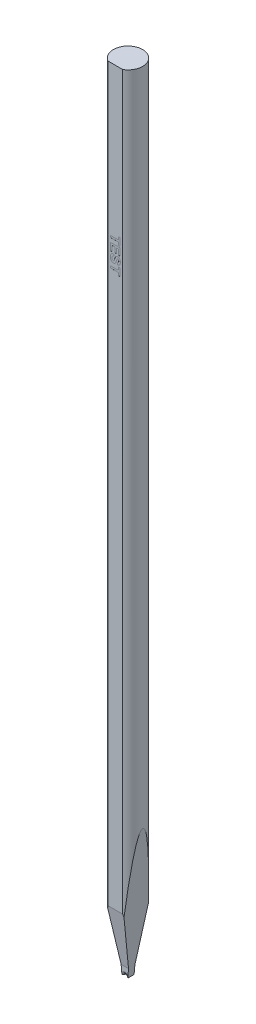
from build123d import *

# Parameters (mm, degrees)
SKETCH_TL_CUTTING_R       = 1.4986
TL_CUTTING_DEPTH          = 81.28
SKETCH_TDF_GRINDING_W     = 3.0172
SKETCH_TDF_GRINDING_H     = 3.0172
TDF_GRINDING_DEPTH        = 82.307625743
ENGRAVING_DEPTH           = 0.005
VW_VR_GRINDING_DEPTH      = 1.5086
VW_VR_GRINDING_DEPTH_BACK = 1.5086
ISA_GRINDING_DEPTH        = 1.5086
ISA_GRINDING_DEPTH_BACK   = 1.5086
PRE_FRX_BRX_DEPTH         = 1.5086
PRE_FRX_BRX_DEPTH_BACK    = 1.5086
SKETCH_PRE_FRX_BRX_W      = 1.18348
SKETCH_PRE_FRX_BRX_H      = 0.889
FR_EDM_R                  = 0.22606
BR_EDM_R                  = 0.22606
FA_BA_GRINDING_DEPTH      = 1.5086
FA_BA_GRINDING_DEPTH_BACK = 1.5086


with BuildPart() as part:
    # sketch_TL_cutting → TL_cutting (new body)
    with BuildSketch(Plane(origin=(0, 0, 0), x_dir=(1, 0, 0), z_dir=(0, 1, 0))):
        Circle(SKETCH_TL_CUTTING_R)
    extrude(amount=TL_CUTTING_DEPTH)

    # sketch_TDF_grinding → TDF_grinding (cut, through all)
    with BuildSketch(Plane(origin=(0, 0, 0), x_dir=(1, 0, 0), z_dir=(0, 1, 0))):
        with Locations((0, -2.804)):
            Rectangle(SKETCH_TDF_GRINDING_W, SKETCH_TDF_GRINDING_H)
    extrude(amount=TDF_GRINDING_DEPTH, mode=Mode.SUBTRACT)

    # sketch_engraving → engraving (cut)
    with BuildSketch(Plane.XY.offset(1.2954)):
        Polygon((-0.5, 65.946666667), (0.333333333, 65.946666667), (0.333333333, 66.241538462), (0.5, 66.241538462), (0.5, 65.459487179), (0.333333333, 65.459487179), (0.333333333, 65.754358974), (-0.5, 65.754358974), align=None)
        Polygon((-0.5, 65.331282051), (0.5, 65.331282051), (0.5, 64.587692308), (0.333333333, 64.587692308), (0.333333333, 65.138974359), (0.115384615, 65.138974359), (0.115384615, 64.626153846), (-0.051282051, 64.626153846), (-0.051282051, 65.138974359), (-0.333333333, 65.138974359), (-0.333333333, 64.574871795), (-0.5, 64.574871795), align=None)
        with BuildLine():
            Line((-0.166666667, 64.459487179), (-0.153846154, 64.267179487))
            add(Edge.make_bspline(
                [(-0.153846154, 64.267179487), (-0.161891279, 64.265646838), (-0.177518424, 64.262669765), (-0.199795017, 64.256065855), (-0.220541784, 64.248759687), (-0.239662803, 64.24014681), (-0.25710555, 64.230281742), (-0.273156714, 64.219491464), (-0.28732832, 64.207248708), (-0.299925293, 64.193917022), (-0.310783278, 64.179343845), (-0.320246275, 64.163643245), (-0.328256178, 64.146721977), (-0.334922245, 64.128644665), (-0.339885492, 64.109231253), (-0.343420115, 64.088663609), (-0.345682646, 64.066908608), (-0.345994208, 64.052040942), (-0.346153846, 64.044423077)],
                knots=[0, 0, 0, 0, 1.20477517, 2.340199137, 3.415898527, 4.440826703, 5.422227366, 6.362763262, 7.28278988, 8.172822029, 9.057410505, 9.952475558, 10.866920142, 11.809098, 12.784128911, 13.811833846, 14.878831738, 16, 16, 16, 16], degree=3))
            add(Edge.make_bspline(
                [(-0.346153846, 64.044423077), (-0.346066367, 64.036404779), (-0.345896216, 64.020808776), (-0.343785338, 63.998208443), (-0.340761278, 63.977076105), (-0.335974263, 63.957598368), (-0.330620744, 63.939411504), (-0.323296559, 63.922967199), (-0.314849171, 63.907999345), (-0.305263574, 63.894546503), (-0.294632459, 63.882806195), (-0.28353392, 63.872535187), (-0.272207737, 63.863589818), (-0.260151301, 63.85654918), (-0.247852227, 63.850851285), (-0.234943611, 63.847085376), (-0.221721863, 63.844541282), (-0.212685699, 63.844249548), (-0.208133013, 63.844102564)],
                knots=[0, 0, 0, 0, 1.417779877, 2.757654889, 4.012140507, 5.189587551, 6.302846416, 7.360586765, 8.365575446, 9.33904572, 10.275781718, 11.161696098, 12.012180333, 12.822428111, 13.625933072, 14.403138519, 15.195454004, 16, 16, 16, 16], degree=3))
            add(Edge.make_bspline(
                [(-0.208133013, 63.844102564), (-0.202439146, 63.844396842), (-0.191320796, 63.844971475), (-0.175220679, 63.848741774), (-0.160658688, 63.855546278), (-0.147071392, 63.864782817), (-0.134926522, 63.877747215), (-0.123459543, 63.89415137), (-0.11316916, 63.914611084), (-0.107424402, 63.929779688), (-0.104366987, 63.937852564)],
                knots=[0, 0, 0, 0, 0.906150226, 1.7694295, 2.610923838, 3.450874087, 4.367551936, 5.419872502, 6.626831617, 8, 8, 8, 8], degree=3))
            add(Edge.make_bspline(
                [(-0.104366987, 63.937852564), (-0.103205903, 63.941316751), (-0.100607587, 63.94906904), (-0.096897182, 63.962295), (-0.092218385, 63.978280402), (-0.087052561, 63.997173825), (-0.081545375, 64.018936731), (-0.074955523, 64.043362379), (-0.068334023, 64.070821678), (-0.063456004, 64.090034741), (-0.060897436, 64.100112179)],
                knots=[0, 0, 0, 0, 0.521824192, 1.167757792, 1.961731518, 2.901193269, 3.965386864, 5.168422915, 6.514810244, 8, 8, 8, 8], degree=3))
            add(Edge.make_bspline(
                [(-0.060897436, 64.100112179), (-0.0576208, 64.113235696), (-0.051299067, 64.138555374), (-0.040053153, 64.174667033), (-0.028879714, 64.207926531), (-0.016755933, 64.238013634), (-0.004503472, 64.265260214), (0.008737874, 64.28922555), (0.022280434, 64.310409746), (0.032402475, 64.322754268), (0.037259615, 64.328677885)],
                knots=[0, 0, 0, 0, 1.293880989, 2.496331788, 3.617634808, 4.64976062, 5.598842568, 6.473791081, 7.267636666, 8, 8, 8, 8], degree=3))
            add(Edge.make_bspline(
                [(0.037259615, 64.328677885), (0.044137694, 64.336023939), (0.057622804, 64.350426557), (0.079781426, 64.369385368), (0.103188466, 64.385315932), (0.127671148, 64.39842853), (0.153370416, 64.408524983), (0.180114252, 64.415681219), (0.207972454, 64.420312995), (0.22694455, 64.420785635), (0.236578526, 64.421025641)],
                knots=[0, 0, 0, 0, 1.064429417, 2.086912298, 3.078678339, 4.055528992, 5.020032834, 5.993708893, 6.981211098, 8, 8, 8, 8], degree=3))
            add(Edge.make_bspline(
                [(0.236578526, 64.421025641), (0.249044725, 64.420558178), (0.273773943, 64.41963087), (0.310123415, 64.411128516), (0.34519423, 64.397880126), (0.373053378, 64.382527737), (0.394102454, 64.367749212), (0.409316468, 64.355522559), (0.423234984, 64.341832745), (0.436363342, 64.327171315), (0.448421192, 64.311292179), (0.459337354, 64.294175805), (0.469762031, 64.276144051), (0.481724432, 64.249831674), (0.494501972, 64.214300806), (0.505216674, 64.168065757), (0.511620444, 64.117719983), (0.512410831, 64.082770721), (0.512820513, 64.064655449)],
                knots=[0, 0, 0, 0, 1.180224575, 2.341213254, 3.519178081, 4.726056898, 5.344182394, 5.956118988, 6.573855441, 7.192564044, 7.82049682, 8.461345463, 9.116141012, 9.79299132, 11.198532007, 12.687823846, 14.283197644, 16, 16, 16, 16], degree=3))
            add(Edge.make_bspline(
                [(0.512820513, 64.064655449), (0.512622915, 64.049822415), (0.512238592, 64.02097248), (0.508327094, 63.979154507), (0.502300976, 63.940146167), (0.493471523, 63.904011321), (0.482080613, 63.870681933), (0.468307987, 63.84009305), (0.4520288, 63.812325051), (0.433078398, 63.787673078), (0.412189308, 63.76570984), (0.389371716, 63.746550603), (0.364914548, 63.73012187), (0.338835479, 63.716317679), (0.311000478, 63.70547728), (0.281444264, 63.697515436), (0.250236407, 63.692249404), (0.228852471, 63.690929457), (0.217948718, 63.69025641)],
                knots=[0, 0, 0, 0, 1.325136797, 2.577362738, 3.74962816, 4.849499017, 5.896771726, 6.892816139, 7.842473141, 8.766187929, 9.665133525, 10.546015357, 11.42313021, 12.293255665, 13.177485873, 14.086514152, 15.024305989, 16, 16, 16, 16], degree=3))
            Line((0.217948718, 63.69025641), (0.205128205, 63.882564103))
            add(Edge.make_bspline(
                [(0.205128205, 63.882564103), (0.211158714, 63.883673027), (0.22291155, 63.885834207), (0.239739753, 63.890541314), (0.255319488, 63.895822081), (0.269550394, 63.902088391), (0.282452554, 63.909306722), (0.29405422, 63.917510903), (0.304442868, 63.926546774), (0.313348905, 63.936795242), (0.321255295, 63.948019416), (0.327770309, 63.960645904), (0.333732615, 63.97428403), (0.338229411, 63.989445002), (0.341791978, 64.005853856), (0.344434282, 64.023515385), (0.34572413, 64.042467598), (0.346007328, 64.055505964), (0.346153846, 64.062251603)],
                knots=[0, 0, 0, 0, 1.150775252, 2.242741279, 3.277646382, 4.23752694, 5.158201782, 6.048759188, 6.901533576, 7.736611693, 8.592238639, 9.472855288, 10.399741491, 11.383322377, 12.435924598, 13.551250831, 14.733094547, 16, 16, 16, 16], degree=3))
            add(Edge.make_bspline(
                [(0.346153846, 64.062251603), (0.346024502, 64.06926523), (0.345772856, 64.082910555), (0.344228543, 64.102795431), (0.34137789, 64.121448937), (0.337667048, 64.138962684), (0.332618703, 64.15531328), (0.326463073, 64.170466219), (0.319216002, 64.184490828), (0.313514257, 64.193042422), (0.310697115, 64.197267628)],
                knots=[0, 0, 0, 0, 1.186678824, 2.308736671, 3.37120409, 4.377216403, 5.334874112, 6.262130804, 7.141346615, 8, 8, 8, 8], degree=3))
            add(Edge.make_bspline(
                [(0.310697115, 64.197267628), (0.30684882, 64.202103022), (0.299395868, 64.211467679), (0.284596838, 64.221546031), (0.267881777, 64.227613222), (0.256061421, 64.228343477), (0.25, 64.228717949)],
                knots=[0, 0, 0, 0, 1.037857257, 2.010007357, 2.979541333, 4, 4, 4, 4], degree=3))
            add(Edge.make_bspline(
                [(0.25, 64.228717949), (0.244335199, 64.228411699), (0.233176443, 64.227808437), (0.217325189, 64.221723758), (0.202637862, 64.212366351), (0.194659513, 64.203623389), (0.190504808, 64.199070513)],
                knots=[0, 0, 0, 0, 0.98538058, 1.941042925, 2.927803204, 4, 4, 4, 4], degree=3))
            add(Edge.make_bspline(
                [(0.190504808, 64.199070513), (0.187808196, 64.195457219), (0.18178239, 64.187383012), (0.17412302, 64.172592664), (0.165827461, 64.154740327), (0.157717635, 64.133419009), (0.149622864, 64.108770412), (0.141170987, 64.080793037), (0.132605635, 64.049469676), (0.124310512, 64.015598747), (0.116156882, 63.981210215), (0.107242663, 63.948394186), (0.098551989, 63.917879998), (0.089442753, 63.889809137), (0.080574939, 63.864036902), (0.071467056, 63.840688486), (0.062596997, 63.819603571), (0.050400038, 63.795016221), (0.033878763, 63.767148934), (0.009862335, 63.737940873), (-0.017133698, 63.71211007), (-0.042589095, 63.694111853), (-0.064481415, 63.68174802), (-0.081932142, 63.673787016), (-0.100320809, 63.666900123), (-0.119667735, 63.661294211), (-0.140000145, 63.657231274), (-0.161162698, 63.653868957), (-0.183331155, 63.652151086), (-0.198448465, 63.651914888), (-0.206129808, 63.651794872)],
                knots=[0, 0, 0, 0, 0.511875881, 1.143829537, 1.88775736, 2.750598373, 3.734912702, 4.837306479, 6.073130119, 7.42648979, 8.801963576, 10.091065733, 11.292408984, 12.408830014, 13.446061236, 14.39066453, 15.257936293, 16.045629259, 17.510392066, 18.929669597, 20.331293837, 21.746891395, 22.460690638, 23.187651344, 23.925159671, 24.69163991, 25.474819891, 26.281170188, 27.126635539, 28, 28, 28, 28], degree=3))
            add(Edge.make_bspline(
                [(-0.206129808, 63.651794872), (-0.213213723, 63.651959898), (-0.227281693, 63.652287624), (-0.248162112, 63.65457786), (-0.268671734, 63.658119654), (-0.288836268, 63.663362726), (-0.308616053, 63.670318192), (-0.328296541, 63.67814951), (-0.347448635, 63.687942071), (-0.366087841, 63.699087568), (-0.384201522, 63.711380711), (-0.400907086, 63.725314284), (-0.416780552, 63.740055612), (-0.430830184, 63.756560723), (-0.444499814, 63.773643959), (-0.456413626, 63.792420246), (-0.467267368, 63.8122888), (-0.476944445, 63.833430724), (-0.485241283, 63.855916056), (-0.492760445, 63.879609726), (-0.498861937, 63.904735261), (-0.504102567, 63.931122199), (-0.508085093, 63.958872973), (-0.510866581, 63.987951218), (-0.512434986, 64.01836402), (-0.512690407, 64.03907945), (-0.512820513, 64.04963141)],
                knots=[0, 0, 0, 0, 0.900523777, 1.788352984, 2.667658312, 3.544829998, 4.433470602, 5.332071549, 6.235671317, 7.16456001, 8.092361829, 9.015217829, 9.927983376, 10.842405559, 11.767913001, 12.707486241, 13.664840466, 14.644960138, 15.660436429, 16.710285012, 17.80361473, 18.945755434, 20.129541241, 21.366238063, 22.658422763, 24, 24, 24, 24], degree=3))
            add(Edge.make_bspline(
                [(-0.512820513, 64.04963141), (-0.512571769, 64.064866814), (-0.512087459, 64.094530507), (-0.507752501, 64.137626527), (-0.501117535, 64.178047736), (-0.491487967, 64.215728351), (-0.47912575, 64.250714363), (-0.463898318, 64.282990034), (-0.445714308, 64.31239848), (-0.4250161, 64.339306724), (-0.401421388, 64.363346069), (-0.37543806, 64.384991703), (-0.346733609, 64.40382454), (-0.315676999, 64.420354557), (-0.28185988, 64.433843417), (-0.245840091, 64.445371406), (-0.207125792, 64.45394819), (-0.180386288, 64.457608917), (-0.166666667, 64.459487179)],
                knots=[0, 0, 0, 0, 1.217919187, 2.371317543, 3.459749122, 4.490553404, 5.476795534, 6.422548752, 7.338285933, 8.236452553, 9.131296239, 10.026155855, 10.935394819, 11.871650654, 12.834387429, 13.842485342, 14.893012909, 16, 16, 16, 16], degree=3))
        make_face()
        Polygon((-0.5, 63.254358974), (0.333333333, 63.254358974), (0.333333333, 63.549230769), (0.5, 63.549230769), (0.5, 62.767179487), (0.333333333, 62.767179487), (0.333333333, 63.062051282), (-0.5, 63.062051282), align=None)
    extrude(amount=-ENGRAVING_DEPTH, mode=Mode.SUBTRACT)

    # sketch_VW_VR_grinding → VW_VR_grinding (cut, two sides: drawn at the far end of the back side and taken through both)
    with BuildSketch(Plane.XY.offset(-VW_VR_GRINDING_DEPTH_BACK)):
        with BuildLine():
            Line((-1.4936, -0.01), (-1.4936, 0.874))
            ThreePointArc((-1.4936, 0.874), (-1.495064466, 0.877535534), (-1.4986, 0.879))
            Line((-1.4986, 0.879), (-1.5086, 0.879))
            Line((-1.5086, 0.879), (-1.5086, -0.01))
            Line((-1.5086, -0.01), (-1.4936, -0.01))
        make_face()
        with BuildLine():
            Line((1.4936, -0.01), (1.4936, 0.874))
            ThreePointArc((1.4936, 0.874), (1.495064466, 0.877535534), (1.4986, 0.879))
            Line((1.4986, 0.879), (1.5086, 0.879))
            Line((1.5086, 0.879), (1.5086, -0.01))
            Line((1.5086, -0.01), (1.4936, -0.01))
        make_face()
    extrude(amount=VW_VR_GRINDING_DEPTH + VW_VR_GRINDING_DEPTH_BACK, mode=Mode.SUBTRACT)

    # sketch_ISA_grinding → ISA_grinding (cut, two sides: drawn at the far end of the back side and taken through both)
    with BuildSketch(Plane.XY.offset(-ISA_GRINDING_DEPTH_BACK)):
        Polygon((-0.29972, 0), (-1.5086, 13.817561628), (-1.5086, -0.01), (1.5086, -0.01), (1.5086, 13.817561628), (0.29972, 0), align=None)
    extrude(amount=ISA_GRINDING_DEPTH + ISA_GRINDING_DEPTH_BACK, mode=Mode.SUBTRACT)

    # sketch_pre_FRX_BRX → pre_FRX_BRX (cut, two sides: drawn at the far end of the back side and taken through both)
    with BuildSketch(Plane(origin=(0, 0, 0), x_dir=(0, 0, -1), z_dir=(1, 0, 0)).offset(-PRE_FRX_BRX_DEPTH_BACK)):
        with Locations((-0.91686, 0.4345)):
            Rectangle(SKETCH_PRE_FRX_BRX_W, SKETCH_PRE_FRX_BRX_H)
        with Locations((0.91686, 0.4345)):
            Rectangle(SKETCH_PRE_FRX_BRX_W, SKETCH_PRE_FRX_BRX_H)
    extrude(amount=PRE_FRX_BRX_DEPTH + PRE_FRX_BRX_DEPTH_BACK, mode=Mode.SUBTRACT)

    # V-Groove_EDM: sweep along a path in sketch_contour_V-Groove
    with BuildLine(Plane(origin=(0, 0, 0), x_dir=(0, 0, -1), z_dir=(1, 0, 0))) as v_groove_edm_path:
        Line((-1.2954, 0.1905), (0, 0.1905))
        Line((0, 0.1905), (1.4986, 0.1905))
    # sketch_section_V-Groove → V-Groove_EDM (sweep, cut)
    with BuildSketch(Plane.XY.offset(1.2954)):
        with BuildLine():
            Line((-1.49899536, -1.905), (-0.049898839, 0.164524309))
            ThreePointArc((-0.049898839, 0.164524309), (0, 0.1905), (0.049898839, 0.164524309))
            Line((0.049898839, 0.164524309), (1.49899536, -1.905))
            Line((1.49899536, -1.905), (-1.49899536, -1.905))
        make_face()
    sweep(path=v_groove_edm_path.line, mode=Mode.SUBTRACT)

    # FR_EDM
    fr_edm_edges = [part.edges().sort_by_distance(p)[0] for p in [
        (0.107499419, 0.082262154, 0.32512),
        (0, 0.1905, 0.32512),
        (-0.107499419, 0.082262154, 0.32512),
    ]]
    fillet(fr_edm_edges, radius=FR_EDM_R)

    # BR_EDM
    br_edm_edges = [part.edges().sort_by_distance(p)[0] for p in [
        (0.107499419, 0.082262154, -0.32512),
        (0, 0.1905, -0.32512),
        (-0.107499419, 0.082262154, -0.32512),
    ]]
    fillet(br_edm_edges, radius=BR_EDM_R)

    # sketch_FA_BA_grinding → FA_BA_grinding (cut, two sides: drawn at the far end of the back side and taken through both)
    with BuildSketch(Plane(origin=(0, 0, 0), x_dir=(0, 0, -1), z_dir=(1, 0, 0)).offset(-FA_BA_GRINDING_DEPTH_BACK)):
        Polygon((2.4986, 13.215417609), (2.4986, -0.1), (0.32512, -0.1), (0.32512, 0.889), align=None)
        Polygon((-4.003016323, 21.747386554), (-0.32512, 0.889), (-0.32512, -0.1), (-4.003016323, -0.1), align=None)
    extrude(amount=FA_BA_GRINDING_DEPTH + FA_BA_GRINDING_DEPTH_BACK, mode=Mode.SUBTRACT)


solid = part.part
